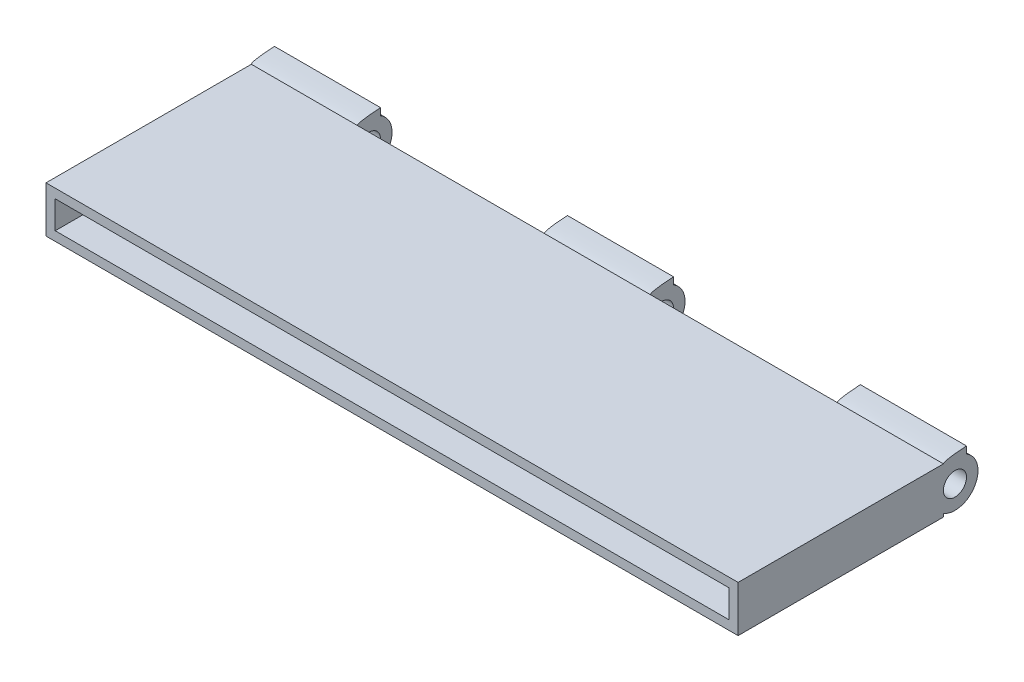
from build123d import *

# Parameters (mm, degrees)
BOSS_EXTRUDE1_DEPTH             = 1
BOSS_EXTRUDE5_DEPTH             = 100
BOSS_EXTRUDE5_DEPTH_BACK        = 1
SKETCH2_W                       = 214
SKETCH2_H                       = 10
FILLET3_SIZE                    = 15
FILLET3_SIZE_2                  = 10
CUT_EXTRUDE2_DEPTH              = 229
SKETCH7_W                       = 64
SKETCH7_H                       = 10
CUT_EXTRUDE3_DEPTH              = 14
SKETCH11_R                      = 5
SKETCH11_R_2                    = 2.5
EXTRUDE_THIN4_DEPTH             = 23
EXTRUDE_THIN5_START             = -63.5
SKETCH11_2_R                    = 5
SKETCH11_2_R_2                  = 2.5
EXTRUDE_THIN5_DEPTH             = 23
EXTRUDE_THIN6_START             = -127
SKETCH11_3_R                    = 5
SKETCH11_3_R_2                  = 2.5
EXTRUDE_THIN6_DEPTH             = 23
SKETCH12_W                      = 210
SKETCH12_H                      = 6
CUT_EXTRUDE4_DEPTH              = 82
CUT_EXTRUDE5_DEPTH              = 180
SKETCH14_W                      = 83.209760426
SKETCH14_H                      = 10
BOSS_EXTRUDE6_DEPTH             = 2
SKETCH15_W                      = 1.646756057
SKETCH15_H                      = 0.570147936
SKETCH15_W_2                    = 1.681570062
SKETCH15_H_2                    = 0.299582691
CUT_EXTRUDE6_DEPTH              = 182
SKETCH16_W                      = 150
SKETCH16_H                      = 42
CUT_EXTRUDE7_DEPTH              = 182
BOSS_EXTRUDE7_REACH             = 107.948
BOSS_EXTRUDE7_END_RADIUS        = 5
BOSS_EXTRUDE7_START             = -10
SKETCH17_W                      = 23
SKETCH17_H                      = 5
BOSS_EXTRUDE7_DIRECTION_2_DEPTH = 1
FILLET5_SIZE                    = 10
FILLET5_SIZE_2                  = 1


with BuildPart() as part:
    # Sketch1 → Boss-Extrude1 (new body)
    with BuildSketch(Plane.XY):
        Polygon((75, 50), (75, -50), (-75, -30), (-75, 30), align=None)
    extrude(amount=BOSS_EXTRUDE1_DEPTH)

    # Sketch2 → Boss-Extrude5 (add, two sides: drawn at the far end of the back side and taken through both)
    with BuildSketch(Plane.XY.offset(1).offset(-BOSS_EXTRUDE5_DEPTH_BACK)):
        with Locations((32, 0)):
            Rectangle(SKETCH2_W, SKETCH2_H)
    extrude(amount=BOSS_EXTRUDE5_DEPTH + BOSS_EXTRUDE5_DEPTH_BACK)

    # Fillet3
    # an asymmetric fillet: 15, 10 mm, written as the material it adds along each edge
    with BuildSketch(Plane(origin=(75, -5, 1), x_dir=(0, 0, 1), z_dir=(-1, 0, 0))) as fillet3_piece_1:
        with BuildLine():
            Bezier((FILLET3_SIZE, 0), (0, 0), (0, -FILLET3_SIZE_2), weights=[1, 0.707106781, 1])
            Line((0, -FILLET3_SIZE_2), (0, 0))
            Line((0, 0), (FILLET3_SIZE, 0))
        make_face()
    extrude(amount=150)
    with BuildSketch(Plane(origin=(-75, 5, 1), x_dir=(0, 1, 0), z_dir=(1, 0, 0))) as fillet3_piece_2:
        with BuildLine():
            Bezier((FILLET3_SIZE_2, 0), (0, 0), (0, FILLET3_SIZE), weights=[1, 0.707106781, 1])
            Line((0, FILLET3_SIZE), (0, 0))
            Line((0, 0), (FILLET3_SIZE_2, 0))
        make_face()
    extrude(amount=150)

    # Sketch6 → Cut-Extrude2 (cut)
    with BuildSketch(Plane.ZY.offset(75)):
        with BuildLine():
            Line((9.5, 6.986773712), (9.5, 4.330127019))
            ThreePointArc((9.5, 4.330127019), (7, 0), (9.5, -4.330127019))
            Line((9.5, -4.330127019), (9.5, -7.297871365))
            Line((9.5, -7.297871365), (14.5, -7.297871365))
            Line((14.5, -7.297871365), (14.5, -4.330127019))
            ThreePointArc((14.5, -4.330127019), (17, 0), (14.5, 4.330127019))
            Line((14.5, 4.330127019), (14.5, 6.986773712))
            Line((14.5, 6.986773712), (9.5, 6.986773712))
        make_face()
    extrude(amount=-CUT_EXTRUDE2_DEPTH, mode=Mode.SUBTRACT)


with BuildPart() as cut_extrude2_piece_1:
    # of the separate pieces the step leaves, piece 1, a body of its own (cut_extrude2_pieces)
    add(part.part.solids().sort_by_distance((-75, 5.050125629, 14.5))[0])

    # Sketch11 → Extrude-Thin4 (add)
    with BuildSketch(Plane.ZY.offset(75)):
        with Locations((12, 0)):
            Circle(SKETCH11_R)
        with Locations((12, 0)):
            Circle(SKETCH11_R_2, mode=Mode.SUBTRACT)
    extrude(amount=-EXTRUDE_THIN4_DEPTH)

    # Sketch11<2> → Extrude-Thin5 (add)
    with BuildSketch(Plane.ZY.offset(75).offset(EXTRUDE_THIN5_START)):
        with Locations((12, 0)):
            Circle(SKETCH11_2_R)
        with Locations((12, 0)):
            Circle(SKETCH11_2_R_2, mode=Mode.SUBTRACT)
    extrude(amount=-EXTRUDE_THIN5_DEPTH)

    # Sketch11<3> → Extrude-Thin6 (add)
    with BuildSketch(Plane.ZY.offset(75).offset(EXTRUDE_THIN6_START)):
        with Locations((12, 0)):
            Circle(SKETCH11_3_R)
        with Locations((12, 0)):
            Circle(SKETCH11_3_R_2, mode=Mode.SUBTRACT)
    extrude(amount=-EXTRUDE_THIN6_DEPTH)

    # Sketch12 → Cut-Extrude4 (cut)
    with BuildSketch(Plane.XY.offset(101)):
        with Locations((32, 0)):
            Rectangle(SKETCH12_W, SKETCH12_H)
    extrude(amount=-CUT_EXTRUDE4_DEPTH, mode=Mode.SUBTRACT)

    # Sketch13 → Cut-Extrude5 (cut)
    with BuildSketch(Plane.XY):
        Polygon((75, 14.806657355), (75, -17.321011219), (144.128197091, -17.321011219), (144.128197091, 20.114706945), (75, 18.438480759), align=None)
    extrude(amount=CUT_EXTRUDE5_DEPTH, mode=Mode.SUBTRACT)

    # Sketch14 → Boss-Extrude6 (add)
    with BuildSketch(Plane(origin=(75, 0, 0), x_dir=(0, 0, -1), z_dir=(1, 0, 0))):
        with Locations((-59.395119787, 0)):
            Rectangle(SKETCH14_W, SKETCH14_H)
    extrude(amount=-BOSS_EXTRUDE6_DEPTH)

    # Sketch15 → Cut-Extrude6 (cut)
    with BuildSketch(Plane(origin=(75, 0, 0), x_dir=(0, 0, -1), z_dir=(1, 0, 0))):
        with Locations((-15.176621972, 5.285073968)):
            Rectangle(SKETCH15_W, SKETCH15_H)
        with Locations((-15.159214969, -5.149791346)):
            Rectangle(SKETCH15_W_2, SKETCH15_H_2)
    extrude(amount=-CUT_EXTRUDE6_DEPTH, mode=Mode.SUBTRACT)

    # Sketch16 → Cut-Extrude7 (cut)
    with BuildSketch(Plane(origin=(0, -5, 0), x_dir=(-1, 0, 0), z_dir=(0, -1, 0))):
        with Locations((0, -80)):
            Rectangle(SKETCH16_W, SKETCH16_H)
    extrude(amount=-CUT_EXTRUDE7_DEPTH, mode=Mode.SUBTRACT)

    # Boss-Extrude7: up to this cylinder (the profile starts outside it)
    boss_extrude7_end = Plane(origin=(0, 0, 12), z_dir=(-1, 0, 0)) * Cylinder(BOSS_EXTRUDE7_END_RADIUS, 353.896, mode=Mode.PRIVATE)
    # Sketch17 → Boss-Extrude7 (add, up to the surface)
    with BuildSketch(Plane.XZ.offset(5).offset(BOSS_EXTRUDE7_START), mode=Mode.PRIVATE) as boss_extrude7_sk1:
        with Locations((63.5, 12)):
            Rectangle(SKETCH17_W, SKETCH17_H)
    boss_extrude7_tool1 = extrude(boss_extrude7_sk1.sketch, amount=BOSS_EXTRUDE7_REACH, mode=Mode.PRIVATE) - boss_extrude7_end
    add(boss_extrude7_tool1.solids().sort_by_distance((63.5, 5, 12))[0])
    add(boss_extrude7_tool1.solids().sort_by_distance((63.5, 5, 12))[1])
    # Sketch17 → Boss-Extrude7 (add, up to the surface)
    with BuildSketch(Plane.XZ.offset(5).offset(BOSS_EXTRUDE7_START), mode=Mode.PRIVATE) as boss_extrude7_sk2:
        with Locations((0, 12)):
            Rectangle(SKETCH17_W, SKETCH17_H)
    boss_extrude7_tool2 = extrude(boss_extrude7_sk2.sketch, amount=BOSS_EXTRUDE7_REACH, mode=Mode.PRIVATE) - boss_extrude7_end
    add(boss_extrude7_tool2.solids().sort_by_distance((0, 5, 12))[0])
    add(boss_extrude7_tool2.solids().sort_by_distance((0, 5, 12))[1])
    # Sketch17 → Boss-Extrude7 (add, up to the surface)
    with BuildSketch(Plane.XZ.offset(5).offset(BOSS_EXTRUDE7_START), mode=Mode.PRIVATE) as boss_extrude7_sk3:
        with Locations((-63.5, 12)):
            Rectangle(SKETCH17_W, SKETCH17_H)
    boss_extrude7_tool3 = extrude(boss_extrude7_sk3.sketch, amount=BOSS_EXTRUDE7_REACH, mode=Mode.PRIVATE) - boss_extrude7_end
    add(boss_extrude7_tool3.solids().sort_by_distance((-63.5, 5, 12))[0])
    add(boss_extrude7_tool3.solids().sort_by_distance((-63.5, 5, 12))[1])

    # Sketch17 → Boss-Extrude7 direction 2 (add)
    with BuildSketch(Plane.XZ.offset(5).offset(BOSS_EXTRUDE7_START)):
        with Locations((63.5, 12)):
            Rectangle(SKETCH17_W, SKETCH17_H)
        with Locations((0, 12)):
            Rectangle(SKETCH17_W, SKETCH17_H)
        with Locations((-63.5, 12)):
            Rectangle(SKETCH17_W, SKETCH17_H)
    extrude(amount=-BOSS_EXTRUDE7_DIRECTION_2_DEPTH)

    # Fillet5
    # an asymmetric fillet: 10, 1 mm, written as the material it takes off along each edge
    with BuildSketch(Plane(origin=(-100, 6, 14.5), x_dir=(0, 0, -1), z_dir=(1, 0, 0)), Plane(origin=(-36.5, 6, 14.5), x_dir=(0, 0, -1), z_dir=(1, 0, 0)), Plane(origin=(27, 6, 14.5), x_dir=(0, 0, -1), z_dir=(1, 0, 0))) as fillet5_piece_1:
        with BuildLine():
            Bezier((FILLET5_SIZE, 0), (0, 0), (0, -FILLET5_SIZE_2), weights=[1, 0.707106781, 1])
            Line((0, -FILLET5_SIZE_2), (0, 0))
            Line((0, 0), (FILLET5_SIZE, 0))
        make_face()
    extrude(amount=73, mode=Mode.SUBTRACT)


with BuildPart() as cut_extrude2_piece_2:
    # of the separate pieces the step leaves, piece 2, a body of its own (cut_extrude2_pieces)
    add(part.part.solids().sort_by_distance((-75, 15, 1))[0])

    # Sketch7 → Cut-Extrude3 (cut)
    with BuildSketch(Plane(origin=(0, 0, 0), x_dir=(-1, 0, 0), z_dir=(0, 0, -1))):
        with Locations((-107, 0)):
            Rectangle(SKETCH7_W, SKETCH7_H)
    extrude(amount=-CUT_EXTRUDE3_DEPTH, mode=Mode.SUBTRACT)


solid = cut_extrude2_piece_1.part
